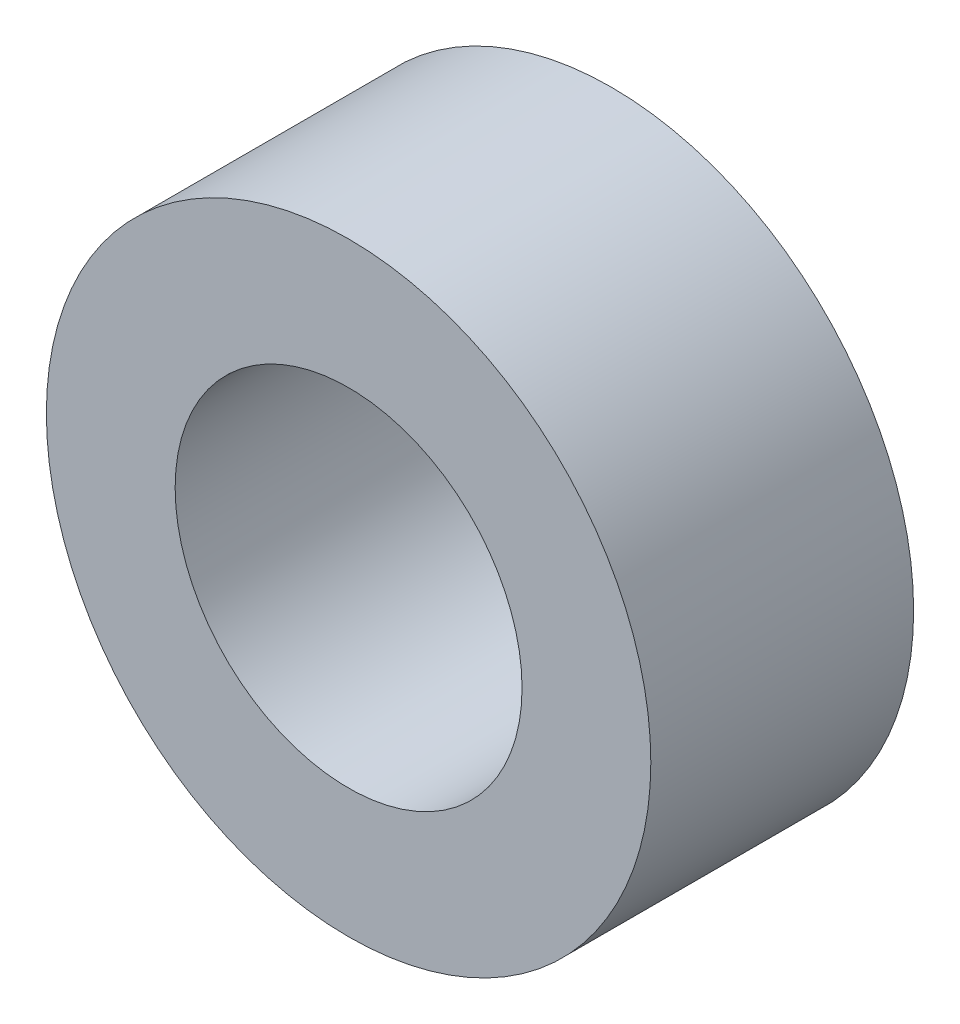
from build123d import *

# Parameters (mm, degrees)
SKETCH1_R           = 2.875
SKETCH1_R_2         = 1.65
BOSS_EXTRUDE1_DEPTH = 2.5


with BuildPart() as part:
    # Sketch1 → Boss-Extrude1 (new body)
    with BuildSketch(Plane.XY):
        Circle(SKETCH1_R)
        Circle(SKETCH1_R_2, mode=Mode.SUBTRACT)
    extrude(amount=BOSS_EXTRUDE1_DEPTH)


solid = part.part
